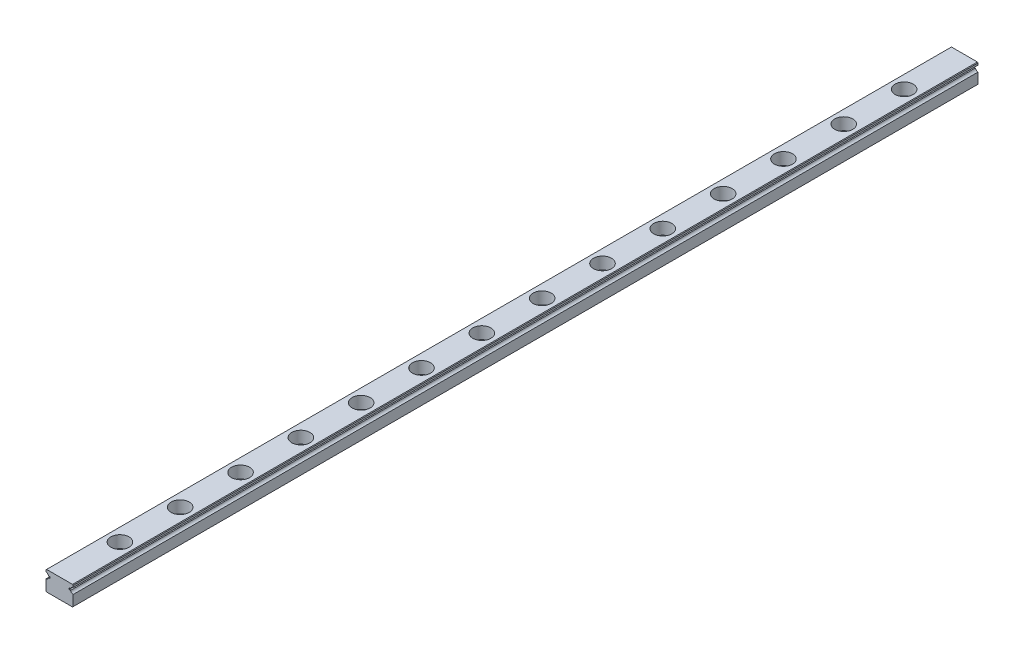
from build123d import *

# Parameters (mm, degrees)
EXTRUDE_RAIL_PROFILE_DEPTH        = 300
INITIAL_MOUNTING_HOLE_D           = 3.5
INITIAL_MOUNTING_HOLE_CBORE_D     = 6
INITIAL_MOUNTING_HOLE_CBORE_DEPTH = 4
FILL_START                        = -2.2
FILL_PATTERN_OUTLINE_R            = 3
FILL_PATTERN_DEPTH                = 4
FILL_START_2                      = -4.7
FILL_PATTERN_2_OUTLINE_R          = 1.75
FILL_PATTERN_2_DEPTH              = 2.5


# Read off the part's stored shape, not the designer's step: Fill Pattern
with BuildPart() as part:
    # Rail Profile Sketch → Extrude Rail Profile (new body)
    with BuildSketch(Plane.XY):
        with BuildLine():
            Line((-4.3, -4.7), (4.3, -4.7))
            Line((4.3, -4.7), (4.5, -4.5))
            Line((4.5, -4.5), (4.5, -0.994987437))
            ThreePointArc((4.5, -0.994987437), (3.948817336, -0.758921035), (3.631754163, -0.25))
            Line((3.631754163, -0.25), (3.131754163, -0.25))
            Line((3.131754163, -0.25), (3.131754163, 0.25))
            Line((3.131754163, 0.25), (3.631754163, 0.25))
            ThreePointArc((3.631754163, 0.25), (3.948817336, 0.758921035), (4.5, 0.994987437))
            Line((4.5, 0.994987437), (4.5, 1.6))
            Line((4.5, 1.6), (4.3, 1.8))
            Line((4.3, 1.8), (-4.3, 1.8))
            Line((-4.3, 1.8), (-4.5, 1.6))
            Line((-4.5, 1.6), (-4.5, 0.994987437))
            ThreePointArc((-4.5, 0.994987437), (-3.948817336, 0.758921035), (-3.631754163, 0.25))
            Line((-3.631754163, 0.25), (-3.131754163, 0.25))
            Line((-3.131754163, 0.25), (-3.131754163, -0.25))
            Line((-3.131754163, -0.25), (-3.631754163, -0.25))
            ThreePointArc((-3.631754163, -0.25), (-3.948817336, -0.758921035), (-4.5, -0.994987437))
            Line((-4.5, -0.994987437), (-4.5, -4.5))
            Line((-4.5, -4.5), (-4.3, -4.7))
        make_face()
    extrude(amount=EXTRUDE_RAIL_PROFILE_DEPTH)

    # Initial Mounting Hole (through all)
    with Locations(Plane(origin=(0, 1.8, 0), x_dir=(1, 0, 0), z_dir=(0, 1, 0))):
        with Locations((0, -140)):
            CounterBoreHole(INITIAL_MOUNTING_HOLE_D / 2, INITIAL_MOUNTING_HOLE_CBORE_D / 2, INITIAL_MOUNTING_HOLE_CBORE_DEPTH)

    # Fill Pattern outline → Fill Pattern (cut)
    with BuildSketch(Plane(origin=(0, 0, 0), x_dir=(1, 0, 0), z_dir=(0, 1, 0)).offset(FILL_START)):
        with Locations((0, -120)):
            Circle(FILL_PATTERN_OUTLINE_R)
        with Locations((0, -160)):
            Circle(FILL_PATTERN_OUTLINE_R)
        with Locations((0, -100)):
            Circle(FILL_PATTERN_OUTLINE_R)
        with Locations((0, -180)):
            Circle(FILL_PATTERN_OUTLINE_R)
        with Locations((0, -80)):
            Circle(FILL_PATTERN_OUTLINE_R)
        with Locations((0, -200)):
            Circle(FILL_PATTERN_OUTLINE_R)
        with Locations((0, -60)):
            Circle(FILL_PATTERN_OUTLINE_R)
        with Locations((0, -220)):
            Circle(FILL_PATTERN_OUTLINE_R)
        with Locations((0, -40)):
            Circle(FILL_PATTERN_OUTLINE_R)
        with Locations((0, -240)):
            Circle(FILL_PATTERN_OUTLINE_R)
        with Locations((0, -20)):
            Circle(FILL_PATTERN_OUTLINE_R)
        with Locations((0, -260)):
            Circle(FILL_PATTERN_OUTLINE_R)
        with Locations((0, -280)):
            Circle(FILL_PATTERN_OUTLINE_R)
    extrude(amount=FILL_PATTERN_DEPTH, mode=Mode.SUBTRACT)

    # Fill Pattern 2 outline → Fill Pattern 2 (cut)
    with BuildSketch(Plane(origin=(0, 0, 0), x_dir=(1, 0, 0), z_dir=(0, 1, 0)).offset(FILL_START_2)):
        with Locations((0, -120)):
            Circle(FILL_PATTERN_2_OUTLINE_R)
        with Locations((0, -160)):
            Circle(FILL_PATTERN_2_OUTLINE_R)
        with Locations((0, -100)):
            Circle(FILL_PATTERN_2_OUTLINE_R)
        with Locations((0, -180)):
            Circle(FILL_PATTERN_2_OUTLINE_R)
        with Locations((0, -80)):
            Circle(FILL_PATTERN_2_OUTLINE_R)
        with Locations((0, -200)):
            Circle(FILL_PATTERN_2_OUTLINE_R)
        with Locations((0, -60)):
            Circle(FILL_PATTERN_2_OUTLINE_R)
        with Locations((0, -220)):
            Circle(FILL_PATTERN_2_OUTLINE_R)
        with Locations((0, -40)):
            Circle(FILL_PATTERN_2_OUTLINE_R)
        with Locations((0, -240)):
            Circle(FILL_PATTERN_2_OUTLINE_R)
        with Locations((0, -20)):
            Circle(FILL_PATTERN_2_OUTLINE_R)
        with Locations((0, -260)):
            Circle(FILL_PATTERN_2_OUTLINE_R)
        with Locations((0, -280)):
            Circle(FILL_PATTERN_2_OUTLINE_R)
    extrude(amount=FILL_PATTERN_2_DEPTH, mode=Mode.SUBTRACT)


solid = part.part
